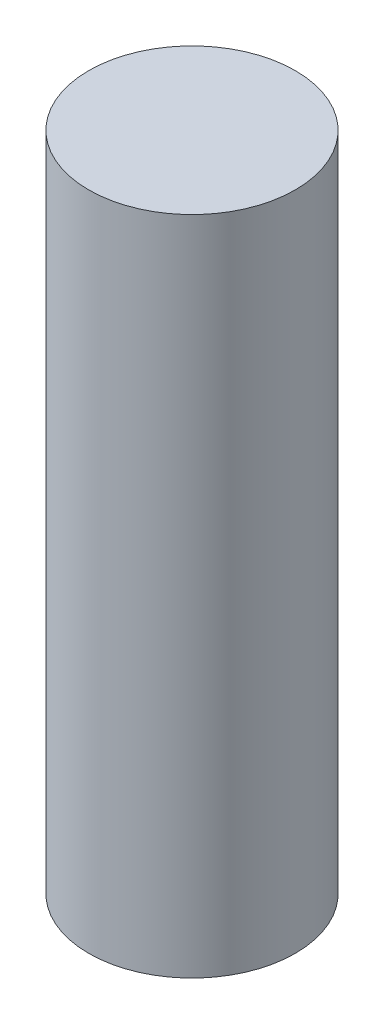
from build123d import *

# Parameters (mm, degrees)
MAIN_PARACHUTE_BAG_PROFILE_R  = 63.5
MAIN_PARACHUTE_BAG_BODY_DEPTH = 406.4


with BuildPart() as part:
    # Main Parachute Bag Profile → Main Parachute Bag Body (new body)
    with BuildSketch(Plane(origin=(0, 0, 0), x_dir=(1, 0, 0), z_dir=(0, 1, 0))):
        Circle(MAIN_PARACHUTE_BAG_PROFILE_R)
    extrude(amount=MAIN_PARACHUTE_BAG_BODY_DEPTH)


solid = part.part
